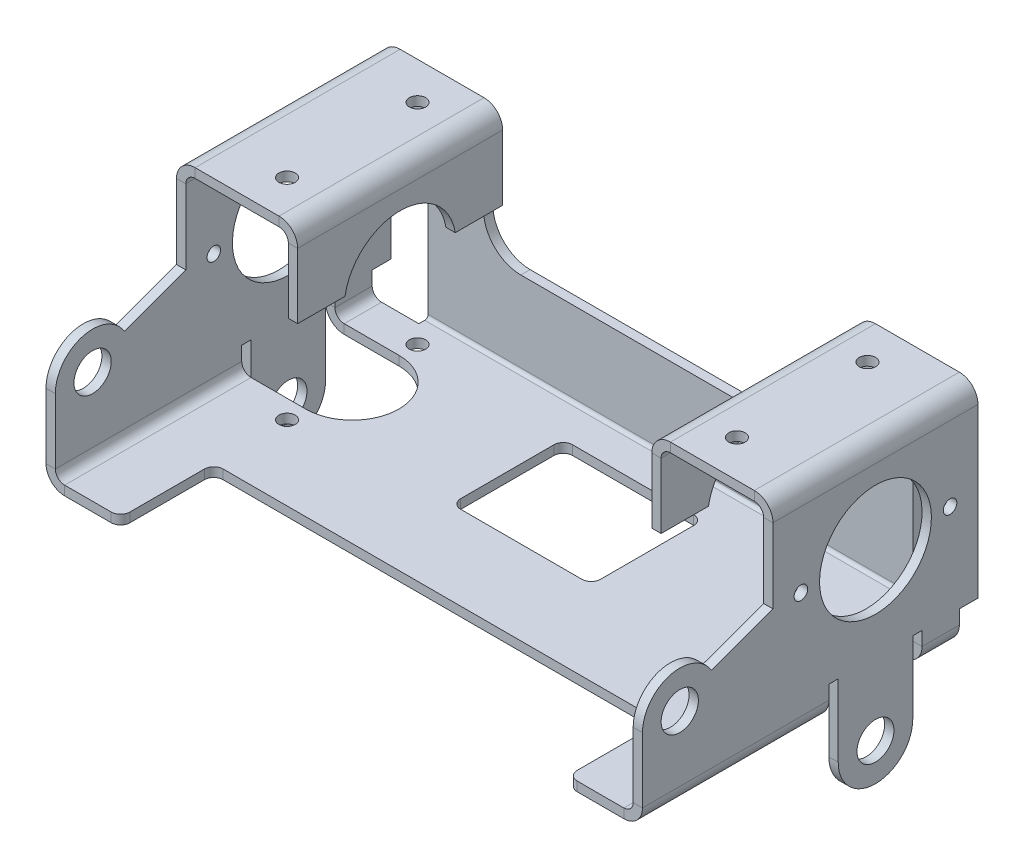
from build123d import *

# Parameters (mm, degrees)
BASE_FLANGE1_DEPTH           = 2
EDGE_FLANGE1_STRIP_W         = 12
EDGE_FLANGE1_STRIP_H         = 2
EDGE_FLANGE1_STRIP_CUT_DEPTH = 68
EDGE_FLANGE1_DEPTH           = 68
EDGE_FLANGE1_START           = 2
EDGE_FLANGE1_PROFILE_R       = 4
EDGE_FLANGE1_PROFILE_R_2     = 1.454422023
EDGE_FLANGE1_PROFILE_R_3     = 12
EDGE_FLANGE1_FLAT_DEPTH      = 2
UNFOLD1_START                = 2
UNFOLD1_DEPTH                = 45
UNFOLD1_2_OUTLINE_R          = 1.454422023
UNFOLD1_2_OUTLINE_R_2        = 4
UNFOLD1_2_OUTLINE_R_3        = 12
UNFOLD1_2_DEPTH              = 2
CUT_EXTRUDE1_REACH           = 128.481
SKETCH38_R                   = 1.75
FOLD1_START                  = -107.71238898
FOLD1_OUTLINE_W              = 2
FOLD1_OUTLINE_H              = 72
FOLD1_DEPTH                  = 44.12334898
FOLD1_START_2                = -62.01096
FOLD1_2_OUTLINE_R            = 1.454422023
FOLD1_2_OUTLINE_R_2          = 12
FOLD1_2_OUTLINE_R_3          = 4
FOLD1_2_DEPTH                = 0.01096
FOLD1_START_3                = -64
FOLD1_3_OUTLINE_R            = 1.454422023
FOLD1_3_OUTLINE_R_2          = 12
FOLD1_3_OUTLINE_R_3          = 4
FOLD1_3_DEPTH                = 4
FOLD1_START_4                = -5.731764935
FOLD1_4_DEPTH                = 72
SKETCH39_R                   = 4
TAB1_DEPTH                   = 2
EDGE_FLANGE2_STRIP_W         = 12
EDGE_FLANGE2_STRIP_H         = 2
EDGE_FLANGE2_STRIP_CUT_DEPTH = 44
EDGE_FLANGE2_DEPTH           = 44
EDGE_FLANGE2_PROFILE_W       = 44
EDGE_FLANGE2_PROFILE_H       = 22
EDGE_FLANGE2_PROFILE_R       = 1.75
EDGE_FLANGE2_FLAT_DEPTH      = 2
EDGE_FLANGE3_STRIP_W         = 12
EDGE_FLANGE3_STRIP_H         = 2
EDGE_FLANGE3_STRIP_CUT_DEPTH = 44
EDGE_FLANGE3_DEPTH           = 44
EDGE_FLANGE3_FLAT_DEPTH      = 2
UNFOLD2_START                = 2
UNFOLD2_OUTLINE_R            = 1.75
UNFOLD2_DEPTH                = 45
UNFOLD2_2_OUTLINE_R          = 4
UNFOLD2_2_OUTLINE_R_2        = 1.454422023
UNFOLD2_2_DEPTH              = 2
UNFOLD2_START_2              = 4
UNFOLD2_3_OUTLINE_W          = 2
UNFOLD2_3_OUTLINE_H          = 44
UNFOLD2_3_DEPTH              = 9.975076938
UNFOLD2_START_3              = 17.475077138
UNFOLD2_4_OUTLINE_W          = 2
UNFOLD2_4_OUTLINE_H          = 44
UNFOLD2_4_DEPTH              = 4.524922862
UNFOLD2_START_4              = 1.78876
UNFOLD2_5_DEPTH              = 0.21124
UNFOLD2_START_5              = 38.268235065
UNFOLD2_6_DEPTH              = 28
UNFOLD2_START_6              = -5.731764935
UNFOLD2_7_OUTLINE_W          = 2
UNFOLD2_7_OUTLINE_H          = 3.5000002
UNFOLD2_7_DEPTH              = 44
UNFOLD2_START_7              = -1.731764935
UNFOLD2_8_DEPTH              = 68
UNFOLD2_START_8              = -1
UNFOLD2_9_DEPTH              = 27
UNFOLD2_START_9              = 105
UNFOLD2_10_OUTLINE_R         = 1.75
UNFOLD2_10_DEPTH             = 4
CUT_EXTRUDE2_REACH           = 136.233
SKETCH48_R                   = 1.75
FOLD2_START                  = -5.731764935
FOLD2_DEPTH                  = 72
FOLD2_2_DEPTH                = 72
FOLD2_START_2                = 26.268235065
FOLD2_3_DEPTH                = 40
FOLD2_START_3                = -1.731764935
FOLD2_4_DEPTH                = 8
FOLD2_START_4                = 38
FOLD2_5_OUTLINE_R            = 4
FOLD2_5_OUTLINE_R_2          = 1.454422023
FOLD2_5_DEPTH                = 26
FOLD2_START_5                = 45
FOLD2_6_OUTLINE_R            = 1.75
FOLD2_6_DEPTH                = 2
TAB2_START                   = -2
SKETCH51_R                   = 3.965306051
TAB2_DEPTH                   = 2
EDGE_FLANGE5_STRIP_W         = 9.4732
EDGE_FLANGE5_STRIP_H         = 2
EDGE_FLANGE5_STRIP_CUT_DEPTH = 104
EDGE_FLANGE5_DEPTH           = 104
EDGE_FLANGE5_FLAT_DEPTH      = 2


with BuildPart() as part:
    # Base-Flange1: sheet metal written as solids
    # Sketch2 → Base-Flange1 (new body)
    with BuildSketch(Plane(origin=(0, 0, 0), x_dir=(1, 0, 0), z_dir=(0, 1, 0))):
        with BuildLine():
            Line((-60, -66.268235065), (-50, -66.268235065))
            ThreePointArc((-50, -66.268235065), (-48.585786438, -65.682448628), (-48, -64.268235065))
            Line((-48, -64.268235065), (-48, -48.268235065))
            ThreePointArc((-48, -48.268235065), (-47.414213562, -46.854021503), (-46, -46.268235065))
            Line((-46, -46.268235065), (46, -46.268235065))
            ThreePointArc((46, -46.268235065), (47.414213562, -46.854021503), (48, -48.268235065))
            Line((48, -48.268235065), (48, -64.268235065))
            ThreePointArc((48, -64.268235065), (48.585786438, -65.682448628), (50, -66.268235065))
            Line((50, -66.268235065), (60, -66.268235065))
            Line((60, -66.268235065), (62, -66.268235065))
            Line((62, -66.268235065), (62, 1.731764935))
            Line((62, 1.731764935), (60, 1.731764935))
            Line((60, 1.731764935), (52, 1.731764935))
            Line((52, 1.731764935), (52, 5.731764935))
            Line((52, 5.731764935), (-52, 5.731764935))
            Line((-52, 5.731764935), (-52, 1.731764935))
            Line((-52, 1.731764935), (-60, 1.731764935))
            Line((-60, 1.731764935), (-62, 1.731764935))
            Line((-62, 1.731764935), (-62, -66.268235065))
            Line((-62, -66.268235065), (-60, -66.268235065))
        make_face()
        with BuildLine():
            Line((-13, -4.268235065), (13, -4.268235065))
            ThreePointArc((13, -4.268235065), (14.414213562, -4.854021503), (15, -6.268235065))
            Line((15, -6.268235065), (15, -26.268235065))
            ThreePointArc((15, -26.268235065), (14.414213562, -27.682448628), (13, -28.268235065))
            Line((13, -28.268235065), (-13, -28.268235065))
            ThreePointArc((-13, -28.268235065), (-14.414213562, -27.682448628), (-15, -26.268235065))
            Line((-15, -26.268235065), (-15, -6.268235065))
            ThreePointArc((-15, -6.268235065), (-14.414213562, -4.854021503), (-13, -4.268235065))
        make_face(mode=Mode.SUBTRACT)
    extrude(amount=BASE_FLANGE1_DEPTH)

    # Edge-Flange1: sheet metal written as solids
    # Edge-Flange1 strip (on a plane across the edge) → Edge-Flange1 strip cut (cut)
    with BuildSketch(Plane(origin=(-62, 2, -1.731764935), x_dir=(1, 0, 0), z_dir=(0, 0, 1))):
        with Locations((-4, -1)):
            Rectangle(EDGE_FLANGE1_STRIP_W, EDGE_FLANGE1_STRIP_H)
    edge_flange1_strip_cut = extrude(amount=EDGE_FLANGE1_STRIP_CUT_DEPTH, mode=Mode.SUBTRACT)

    # Edge-Flange1 bend section (on a plane across the edge) → Edge-Flange1 (add)
    with BuildSketch(Plane(origin=(-62, 2, -1.731764935), x_dir=(1, 0, 0), z_dir=(0, 0, 1))):
        with BuildLine():
            Line((-2, 2), (0, 2))
            ThreePointArc((0, 2), (0.585786438, 0.585786438), (2, 0))
            Line((2, 0), (2, -2))
            ThreePointArc((2, -2), (-0.828427125, -0.828427125), (-2, 2))
        make_face()
    edge_flange1 = extrude(amount=EDGE_FLANGE1_DEPTH)

    # Edge-Flange1 profile (on flange) → Edge-Flange1 flat (add)
    with BuildSketch(Plane(origin=(-62, 2, 0), x_dir=(0, 0, 1), z_dir=(-1, 0, 0)).offset(EDGE_FLANGE1_START)):
        with BuildLine():
            Line((66.268235065, 2), (66.268235065, 16))
            ThreePointArc((66.268235065, 16), (60.450508139, 23.696602123), (51.458814007, 20.199021892))
            Line((51.458814007, 20.199021892), (38.268235065, 25))
            Line((38.268235065, 25), (38.268235065, 45))
            Line((38.268235065, 45), (-5.731764935, 45))
            Line((-5.731764935, 45), (-5.731764935, 5))
            Line((-5.731764935, 5), (-1.731764935, 5))
            Line((-1.731764935, 5), (-1.731764935, 2))
            Line((-1.731764935, 2), (66.268235065, 2))
        make_face()
        with Locations((58.268235065, 16)):
            Circle(EDGE_FLANGE1_PROFILE_R, mode=Mode.SUBTRACT)
        with Locations((32.268235065, 25)):
            Circle(EDGE_FLANGE1_PROFILE_R_2, mode=Mode.SUBTRACT)
        with Locations((16.268235065, 25)):
            Circle(EDGE_FLANGE1_PROFILE_R_3, mode=Mode.SUBTRACT)
        with Locations((0.268235065, 25)):
            Circle(EDGE_FLANGE1_PROFILE_R_2, mode=Mode.SUBTRACT)
    edge_flange1_flat = extrude(amount=-EDGE_FLANGE1_FLAT_DEPTH)

    # Unfold1: read off the stored shape, not the designer's step
    # Unfold1 outline → Unfold1 (cut)
    with BuildSketch(Plane(origin=(0, 0, 0), x_dir=(1, 0, 0), z_dir=(0, 1, 0)).offset(UNFOLD1_START)):
        Polygon((-64, 1.731764935), (-64.71238898, 1.731764935), (-64.71238898, -66.268235065), (-60, -66.268235065), (-60, 1.731764935), (-62, 1.731764935), (-62, 5.731764935), (-64, 5.731764935), align=None)
    extrude(amount=UNFOLD1_DEPTH, mode=Mode.SUBTRACT)

    # Unfold1 2 outline → Unfold1 2 (add)
    with BuildSketch(Plane(origin=(0, 0, 0), x_dir=(1, 0, 0), z_dir=(0, 1, 0))):
        with BuildLine():
            Line((-67.71238898, 1.731764935), (-67.71238898, 5.731764935))
            Line((-67.71238898, 5.731764935), (-107.71238898, 5.731764935))
            Line((-107.71238898, 5.731764935), (-107.71238898, -38.268235065))
            Line((-107.71238898, -38.268235065), (-87.71238898, -38.268235065))
            Line((-87.71238898, -38.268235065), (-82.911410873, -51.458814007))
            ThreePointArc((-82.911410873, -51.458814007), (-86.408991103, -60.450508139), (-78.71238898, -66.268235065))
            Line((-78.71238898, -66.268235065), (-60, -66.268235065))
            Line((-60, -66.268235065), (-60, 1.731764935))
            Line((-60, 1.731764935), (-67.71238898, 1.731764935))
        make_face()
        with Locations((-87.71238898, -32.268235065)):
            Circle(UNFOLD1_2_OUTLINE_R, mode=Mode.SUBTRACT)
        with Locations((-78.71238898, -58.268235065)):
            Circle(UNFOLD1_2_OUTLINE_R_2, mode=Mode.SUBTRACT)
        with Locations((-87.71238898, -16.268235065)):
            Circle(UNFOLD1_2_OUTLINE_R_3, mode=Mode.SUBTRACT)
        with Locations((-87.71238898, -0.268235065)):
            Circle(UNFOLD1_2_OUTLINE_R, mode=Mode.SUBTRACT)
    extrude(amount=UNFOLD1_2_DEPTH)

    # Sketch38 → Cut-Extrude1 (cut, up to next)
    with BuildSketch(Plane(origin=(0, 2, 0), x_dir=(1, 0, 0), z_dir=(0, 1, 0)), mode=Mode.PRIVATE) as cut_extrude1_sk1:
        with Locations(Location((-48.274922962, -2.268235065, 0), (0, 0, 270))):
            Circle(SKETCH38_R)
    cut_extrude1_tool1 = extrude(cut_extrude1_sk1.sketch, amount=-CUT_EXTRUDE1_REACH, mode=Mode.PRIVATE) & part.part
    # Sketch38 → Cut-Extrude1 (cut, up to next)
    with BuildSketch(Plane(origin=(0, 2, 0), x_dir=(1, 0, 0), z_dir=(0, 1, 0)), mode=Mode.PRIVATE) as cut_extrude1_sk2:
        with Locations(Location((-48.274922962, -30.268235065, 0), (0, 0, 270))):
            Circle(SKETCH38_R)
    cut_extrude1_tool2 = extrude(cut_extrude1_sk2.sketch, amount=-CUT_EXTRUDE1_REACH, mode=Mode.PRIVATE) & part.part
    # Sketch38 → Cut-Extrude1 (cut, up to next)
    with BuildSketch(Plane(origin=(0, 2, 0), x_dir=(1, 0, 0), z_dir=(0, 1, 0)), mode=Mode.PRIVATE) as cut_extrude1_sk3:
        with BuildLine():
            Line((-67.71238898, -6.268235065), (-48.274922962, -6.268235065))
            ThreePointArc((-48.274922962, -6.268235065), (-38.274922962, -16.268235065), (-48.274922962, -26.268235065))
            Line((-48.274922962, -26.268235065), (-67.71238898, -26.268235065))
            Line((-67.71238898, -26.268235065), (-67.71238898, -6.268235065))
        make_face()
    cut_extrude1_tool3 = extrude(cut_extrude1_sk3.sketch, amount=-CUT_EXTRUDE1_REACH, mode=Mode.PRIVATE) & part.part
    add(cut_extrude1_tool1.solids().sort_by_distance((-48.274923, 2, 2.268235))[0], mode=Mode.SUBTRACT)
    add(cut_extrude1_tool2.solids().sort_by_distance((-48.274923, 2, 30.268235))[0], mode=Mode.SUBTRACT)
    add(cut_extrude1_tool3.solids().sort_by_distance((-53.975398, 2, 16.268235))[0], mode=Mode.SUBTRACT)

    # Fold1: read off the stored shape, not the designer's step
    # Fold1 outline → Fold1 (cut)
    with BuildSketch(Plane.YZ.offset(FOLD1_START)):
        with Locations((1, 30.268235065)):
            Rectangle(FOLD1_OUTLINE_W, FOLD1_OUTLINE_H)
    extrude(amount=FOLD1_DEPTH, mode=Mode.SUBTRACT)

    # Fold1 2 outline → Fold1 2 (add)
    with BuildSketch(Plane.YZ.offset(FOLD1_START_2)):
        with BuildLine():
            Line((2, 26.268235065), (7, 26.268235065))
            Line((7, 26.268235065), (7, 6.268235065))
            Line((7, 6.268235065), (2, 6.268235065))
            Line((2, 6.268235065), (2, -1.731764935))
            Line((2, -1.731764935), (7, -1.731764935))
            Line((7, -1.731764935), (7, -5.731764935))
            Line((7, -5.731764935), (47, -5.731764935))
            Line((47, -5.731764935), (47, 38.268235065))
            Line((47, 38.268235065), (27, 38.268235065))
            Line((27, 38.268235065), (22.199021892, 51.458814007))
            ThreePointArc((22.199021892, 51.458814007), (25.696602123, 60.450508139), (18, 66.268235065))
            Line((18, 66.268235065), (2, 66.268235065))
            Line((2, 66.268235065), (2, 26.268235065))
        make_face()
        with Locations((27, 0.268235065)):
            Circle(FOLD1_2_OUTLINE_R, mode=Mode.SUBTRACT)
        with Locations((27, 16.268235065)):
            Circle(FOLD1_2_OUTLINE_R_2, mode=Mode.SUBTRACT)
        with Locations((18, 58.268235065)):
            Circle(FOLD1_2_OUTLINE_R_3, mode=Mode.SUBTRACT)
        with Locations((27, 32.268235065)):
            Circle(FOLD1_2_OUTLINE_R, mode=Mode.SUBTRACT)
    extrude(amount=FOLD1_2_DEPTH)

    # Fold1 3 outline → Fold1 3 (add)
    with BuildSketch(Plane.YZ.offset(FOLD1_START_3)):
        with BuildLine():
            Line((2, 26.268235065), (7, 26.268235065))
            Line((7, 26.268235065), (7, 6.268235065))
            Line((7, 6.268235065), (2, 6.268235065))
            Line((2, 6.268235065), (2, -1.731764935))
            Line((2, -1.731764935), (7, -1.731764935))
            Line((7, -1.731764935), (7, -5.731764935))
            Line((7, -5.731764935), (47, -5.731764935))
            Line((47, -5.731764935), (47, 38.268235065))
            Line((47, 38.268235065), (27, 38.268235065))
            Line((27, 38.268235065), (22.199021892, 51.458814007))
            ThreePointArc((22.199021892, 51.458814007), (25.696602123, 60.450508139), (18, 66.268235065))
            Line((18, 66.268235065), (2, 66.268235065))
            Line((2, 66.268235065), (2, 26.268235065))
        make_face()
        with Locations((27, 0.268235065)):
            Circle(FOLD1_3_OUTLINE_R, mode=Mode.SUBTRACT)
        with Locations((27, 16.268235065)):
            Circle(FOLD1_3_OUTLINE_R_2, mode=Mode.SUBTRACT)
        with Locations((18, 58.268235065)):
            Circle(FOLD1_3_OUTLINE_R_3, mode=Mode.SUBTRACT)
        with Locations((27, 32.268235065)):
            Circle(FOLD1_3_OUTLINE_R, mode=Mode.SUBTRACT)
    extrude(amount=FOLD1_3_DEPTH)

    # Fold1 4 outline → Fold1 4 (cut)
    with BuildSketch(Plane.XY.offset(FOLD1_START_4)):
        with BuildLine():
            Line((-60, 47), (-62, 47))
            Line((-62, 47), (-62, 4))
            ThreePointArc((-62, 4), (-61.414213562, 2.585786438), (-60, 2))
            Line((-60, 2), (-60, 47))
        make_face()
        with BuildLine():
            ThreePointArc((-60, 0), (-62.828427125, 1.171572875), (-64, 4))
            Line((-64, 4), (-64, 2))
            Line((-64, 2), (-63.58904, 2))
            Line((-63.58904, 2), (-63.58904, 0))
            Line((-63.58904, 0), (-60, 0))
        make_face()
    extrude(amount=FOLD1_4_DEPTH, mode=Mode.SUBTRACT)

    # Tab1: sheet metal written as solids
    # Sketch39 → Tab1 (add)
    with BuildSketch(Plane.ZY.offset(64)):
        with BuildLine():
            Line((8.268235065, 7), (24.268235065, 7))
            Line((24.268235065, 7), (24.268235065, -8.507457044))
            ThreePointArc((24.268235065, -8.507457044), (16.268235065, -16.507457044), (8.268235065, -8.507457044))
            Line((8.268235065, -8.507457044), (8.268235065, 7))
        make_face()
        with Locations(Location((16.268235065, -8.507457044, 0), (0, 0, 270))):
            Circle(SKETCH39_R, mode=Mode.SUBTRACT)
    extrude(amount=-TAB1_DEPTH)

    # Edge-Flange2: sheet metal written as solids
    # Edge-Flange2 strip (on a plane across the edge) → Edge-Flange2 strip cut (cut)
    with BuildSketch(Plane(origin=(-62, 47, -5.731764935), x_dir=(0, -1, 0), z_dir=(0, 0, 1))):
        with Locations((-2, -1)):
            Rectangle(EDGE_FLANGE2_STRIP_W, EDGE_FLANGE2_STRIP_H)
    edge_flange2_strip_cut = extrude(amount=EDGE_FLANGE2_STRIP_CUT_DEPTH, mode=Mode.SUBTRACT)

    # Edge-Flange2 bend section (on a plane across the edge) → Edge-Flange2 (add)
    with BuildSketch(Plane(origin=(-62, 47, -5.731764935), x_dir=(0, -1, 0), z_dir=(0, 0, 1))):
        with BuildLine():
            Line((0, 2), (2, 2))
            ThreePointArc((2, 2), (2.585786438, 0.585786438), (4, 0))
            Line((4, 0), (4, -2))
            ThreePointArc((4, -2), (1.171572875, -0.828427125), (0, 2))
        make_face()
    edge_flange2 = extrude(amount=EDGE_FLANGE2_DEPTH)

    # Edge-Flange2 profile (on flange) → Edge-Flange2 flat (add)
    with BuildSketch(Plane(origin=(-62, 47, 0), x_dir=(0, 0, 1), z_dir=(0, 1, 0))):
        with Locations((16.268235065, 13)):
            Rectangle(EDGE_FLANGE2_PROFILE_W, EDGE_FLANGE2_PROFILE_H)
        with Locations((30.268235065, 13.725077038)):
            Circle(EDGE_FLANGE2_PROFILE_R, mode=Mode.SUBTRACT)
        with Locations((2.268235065, 13.725077038)):
            Circle(EDGE_FLANGE2_PROFILE_R, mode=Mode.SUBTRACT)
    edge_flange2_flat = extrude(amount=-EDGE_FLANGE2_FLAT_DEPTH)

    # Edge-Flange3: sheet metal written as solids
    # Edge-Flange3 strip (on a plane across the edge) → Edge-Flange3 strip cut (cut)
    with BuildSketch(Plane(origin=(-38, 45, -5.731764935), x_dir=(-1, 0, 0), z_dir=(0, 0, 1))):
        with Locations((-2, -1)):
            Rectangle(EDGE_FLANGE3_STRIP_W, EDGE_FLANGE3_STRIP_H)
    edge_flange3_strip_cut = extrude(amount=EDGE_FLANGE3_STRIP_CUT_DEPTH, mode=Mode.SUBTRACT)

    # Edge-Flange3 bend section (on a plane across the edge) → Edge-Flange3 (add)
    with BuildSketch(Plane(origin=(-38, 45, -5.731764935), x_dir=(-1, 0, 0), z_dir=(0, 0, 1))):
        with BuildLine():
            Line((0, 2), (2, 2))
            ThreePointArc((2, 2), (2.585786438, 0.585786438), (4, 0))
            Line((4, 0), (4, -2))
            ThreePointArc((4, -2), (1.171572875, -0.828427125), (0, 2))
        make_face()
    edge_flange3 = extrude(amount=EDGE_FLANGE3_DEPTH)

    # Edge-Flange3 profile (on flange) → Edge-Flange3 flat (add)
    with BuildSketch(Plane(origin=(-38, 45, 0), x_dir=(0, 0, 1), z_dir=(1, 0, 0))):
        with BuildLine():
            ThreePointArc((28.100394631, 16), (16.268235065, 6), (4.436075499, 16))
            Line((4.436075499, 16), (-5.731764935, 16))
            Line((-5.731764935, 16), (-5.731764935, 2))
            Line((-5.731764935, 2), (38.268235065, 2))
            Line((38.268235065, 2), (38.268235065, 16))
            Line((38.268235065, 16), (28.100394631, 16))
        make_face()
    edge_flange3_flat = extrude(amount=-EDGE_FLANGE3_FLAT_DEPTH)

    # Mirror2: Edge-Flange1 strip cut, Edge-Flange1, Edge-Flange1 flat, Edge-Flange2 strip cut, Edge-Flange2, Edge-Flange2 flat, Edge-Flange3 strip cut, Edge-Flange3, Edge-Flange3 flat across plane
    add(edge_flange1_strip_cut.mirror(Plane(origin=(0, 0, 0), x_dir=(0, 0, 1), z_dir=(1, 0, 0))), mode=Mode.SUBTRACT)
    add(edge_flange1.mirror(Plane(origin=(0, 0, 0), x_dir=(0, 0, 1), z_dir=(1, 0, 0))))
    add(edge_flange1_flat.mirror(Plane(origin=(0, 0, 0), x_dir=(0, 0, 1), z_dir=(1, 0, 0))))
    add(edge_flange2_strip_cut.mirror(Plane(origin=(0, 0, 0), x_dir=(0, 0, 1), z_dir=(1, 0, 0))), mode=Mode.SUBTRACT)
    add(edge_flange2.mirror(Plane(origin=(0, 0, 0), x_dir=(0, 0, 1), z_dir=(1, 0, 0))))
    add(edge_flange2_flat.mirror(Plane(origin=(0, 0, 0), x_dir=(0, 0, 1), z_dir=(1, 0, 0))))
    add(edge_flange3_strip_cut.mirror(Plane(origin=(0, 0, 0), x_dir=(0, 0, 1), z_dir=(1, 0, 0))), mode=Mode.SUBTRACT)
    add(edge_flange3.mirror(Plane(origin=(0, 0, 0), x_dir=(0, 0, 1), z_dir=(1, 0, 0))))
    add(edge_flange3_flat.mirror(Plane(origin=(0, 0, 0), x_dir=(0, 0, 1), z_dir=(1, 0, 0))))

    # Unfold2: read off the stored shape, not the designer's step
    # Unfold2 outline → Unfold2 (cut)
    with BuildSketch(Plane(origin=(0, 0, 0), x_dir=(1, 0, 0), z_dir=(0, 1, 0)).offset(UNFOLD2_START)):
        Polygon((64, 5.731764935), (38, 5.731764935), (38, -38.268235065), (62, -38.268235065), (62, -66.268235065), (64, -66.268235065), align=None)
        with Locations((48.274922962, -30.268235065)):
            Circle(UNFOLD2_OUTLINE_R, mode=Mode.SUBTRACT)
        with Locations((48.274922962, -2.268235065)):
            Circle(UNFOLD2_OUTLINE_R, mode=Mode.SUBTRACT)
    extrude(amount=UNFOLD2_DEPTH, mode=Mode.SUBTRACT)

    # Unfold2 2 outline → Unfold2 2 (add)
    with BuildSketch(Plane(origin=(0, 0, 0), x_dir=(1, 0, 0), z_dir=(0, 1, 0))):
        with BuildLine():
            Line((67.71238898, 1.731764935), (62, 1.731764935))
            Line((62, 1.731764935), (62, -66.268235065))
            Line((62, -66.268235065), (78.71238898, -66.268235065))
            ThreePointArc((78.71238898, -66.268235065), (86.408991103, -60.450508139), (82.911410873, -51.458814007))
            Line((82.911410873, -51.458814007), (87.71238898, -38.268235065))
            Line((87.71238898, -38.268235065), (89.71238898, -38.268235065))
            Line((89.71238898, -38.268235065), (89.71238898, -28.100394631))
            ThreePointArc((89.71238898, -28.100394631), (75.71238898, -16.268235065), (89.71238898, -4.436075499))
            Line((89.71238898, -4.436075499), (89.71238898, 5.731764935))
            Line((89.71238898, 5.731764935), (67.71238898, 5.731764935))
            Line((67.71238898, 5.731764935), (67.71238898, 1.731764935))
        make_face()
        with Locations((78.71238898, -58.268235065)):
            Circle(UNFOLD2_2_OUTLINE_R, mode=Mode.SUBTRACT)
        with Locations((87.71238898, -32.268235065)):
            Circle(UNFOLD2_2_OUTLINE_R_2, mode=Mode.SUBTRACT)
        with Locations((87.71238898, -0.268235065)):
            Circle(UNFOLD2_2_OUTLINE_R_2, mode=Mode.SUBTRACT)
    extrude(amount=UNFOLD2_2_DEPTH)

    # Unfold2 5 outline → Unfold2 5 (add)
    with BuildSketch(Plane(origin=(0, 0, 0), x_dir=(1, 0, 0), z_dir=(0, 1, 0)).offset(UNFOLD2_START_4)):
        with BuildLine():
            Line((105.71238898, 5.731764935), (89.71238898, 5.731764935))
            Line((89.71238898, 5.731764935), (89.71238898, -4.436075499))
            ThreePointArc((89.71238898, -4.436075499), (99.71238898, -16.268235065), (89.71238898, -28.100394631))
            Line((89.71238898, -28.100394631), (89.71238898, -38.268235065))
            Line((89.71238898, -38.268235065), (105.71238898, -38.268235065))
            Line((105.71238898, -38.268235065), (105.71238898, 5.731764935))
        make_face()
    extrude(amount=UNFOLD2_5_DEPTH)

    # Unfold2 6 outline → Unfold2 6 (cut)
    with BuildSketch(Plane.XY.offset(UNFOLD2_START_5)):
        with BuildLine():
            Line((60, 2), (62, 2))
            Line((62, 2), (62, 4))
            ThreePointArc((62, 4), (61.414213562, 2.585786438), (60, 2))
        make_face()
    extrude(amount=UNFOLD2_6_DEPTH, mode=Mode.SUBTRACT)



with BuildPart() as body_2:
    # Unfold2 3 outline → Unfold2 3 (new body)
    with BuildSketch(Plane(origin=(0, 0, 0), x_dir=(1, 0, 0), z_dir=(0, 1, 0)).offset(UNFOLD2_START_2)):
        with Locations((106.71238898, -16.268235065)):
            Rectangle(UNFOLD2_3_OUTLINE_W, UNFOLD2_3_OUTLINE_H)
    extrude(amount=UNFOLD2_3_DEPTH)


with BuildPart() as body_3:
    # Unfold2 4 outline → Unfold2 4 (new body)
    with BuildSketch(Plane(origin=(0, 0, 0), x_dir=(1, 0, 0), z_dir=(0, 1, 0)).offset(UNFOLD2_START_3)):
        with Locations((106.71238898, -16.268235065)):
            Rectangle(UNFOLD2_4_OUTLINE_W, UNFOLD2_4_OUTLINE_H)
    extrude(amount=UNFOLD2_4_DEPTH)


with BuildPart() as part_1:
    add(part.part)

    add(body_2.part)  # Unfold2 7 merges body 2

    add(body_3.part)  # Unfold2 7 merges body 3
    # Unfold2 7 outline → Unfold2 7 (add)
    with BuildSketch(Plane.XY.offset(UNFOLD2_START_6)):
        with BuildLine():
            ThreePointArc((105.71238898, 4), (105.126602542, 2.585786437), (103.71238898, 2))
            Line((103.71238898, 2), (105.71238898, 2))
            Line((105.71238898, 2), (105.71238898, 1.78876))
            Line((105.71238898, 1.78876), (89.71238898, 1.78876))
            Line((89.71238898, 1.78876), (89.71238898, 0))
            Line((89.71238898, 0), (103.71238898, 0))
            ThreePointArc((103.71238898, 0), (106.540816105, 1.171572875), (107.71238898, 4))
            Line((107.71238898, 4), (105.71238898, 4))
        make_face()
        with Locations((106.71238898, 15.725077038)):
            Rectangle(UNFOLD2_7_OUTLINE_W, UNFOLD2_7_OUTLINE_H)
        with BuildLine():
            ThreePointArc((103.71238898, 24), (105.126602542, 23.414213563), (105.71238898, 22))
            Line((105.71238898, 22), (107.71238898, 22))
            ThreePointArc((107.71238898, 22), (106.540816105, 24.828427125), (103.71238898, 26))
            Line((103.71238898, 26), (89.71238898, 26))
            Line((89.71238898, 26), (89.71238898, 24))
            Line((89.71238898, 24), (103.71238898, 24))
        make_face()
    extrude(amount=UNFOLD2_7_DEPTH)

    # Unfold2 8 outline → Unfold2 8 (add)
    with BuildSketch(Plane.XY.offset(UNFOLD2_START_7)):
        with BuildLine():
            Line((60, 0), (62, 0))
            Line((62, 0), (62, 0.535898385))
            ThreePointArc((62, 0.535898385), (61.03527618, 0.136296695), (60, 0))
        make_face()
    extrude(amount=UNFOLD2_8_DEPTH)

    # Unfold2 9 outline → Unfold2 9 (cut)
    with BuildSketch(Plane(origin=(0, 0, 0), x_dir=(1, 0, 0), z_dir=(0, 1, 0)).offset(UNFOLD2_START_8)):
        with BuildLine():
            ThreePointArc((89.71238898, -28.100394631), (99.71238898, -16.268235065), (89.71238898, -4.436075499))
            Line((89.71238898, -4.436075499), (89.71238898, -28.100394631))
        make_face()
    extrude(amount=UNFOLD2_9_DEPTH, mode=Mode.SUBTRACT)

    # Unfold2 10 outline → Unfold2 10 (cut)
    with BuildSketch(Plane.YZ.offset(UNFOLD2_START_9)):
        with Locations((15.725077038, 2.268235065)):
            Circle(UNFOLD2_10_OUTLINE_R)
        with Locations((15.725077038, 30.268235065)):
            Circle(UNFOLD2_10_OUTLINE_R)
    extrude(amount=UNFOLD2_10_DEPTH, mode=Mode.SUBTRACT)

    # Sketch48 → Cut-Extrude2 (cut, up to next)
    with BuildSketch(Plane(origin=(0, 2, 0), x_dir=(1, 0, 0), z_dir=(0, 1, 0)), mode=Mode.PRIVATE) as cut_extrude2_sk1:
        with Locations(Location((52.71238898, -2.268235065, 0), (0, 0, 270))):
            Circle(SKETCH48_R)
    cut_extrude2_tool1 = extrude(cut_extrude2_sk1.sketch, amount=-CUT_EXTRUDE2_REACH, mode=Mode.PRIVATE) & part_1.part
    # Sketch48 → Cut-Extrude2 (cut, up to next)
    with BuildSketch(Plane(origin=(0, 2, 0), x_dir=(1, 0, 0), z_dir=(0, 1, 0)), mode=Mode.PRIVATE) as cut_extrude2_sk2:
        with Locations(Location((52.71238898, -30.268235065, 0), (0, 0, 270))):
            Circle(SKETCH48_R)
    cut_extrude2_tool2 = extrude(cut_extrude2_sk2.sketch, amount=-CUT_EXTRUDE2_REACH, mode=Mode.PRIVATE) & part_1.part
    # Sketch48 → Cut-Extrude2 (cut, up to next)
    with BuildSketch(Plane(origin=(0, 2, 0), x_dir=(1, 0, 0), z_dir=(0, 1, 0)), mode=Mode.PRIVATE) as cut_extrude2_sk3:
        with BuildLine():
            Line((67.71238898, -6.268235065), (52.71238898, -6.268235065))
            ThreePointArc((52.71238898, -6.268235065), (42.71238898, -16.268235065), (52.71238898, -26.268235065))
            Line((52.71238898, -26.268235065), (67.71238898, -26.268235065))
            Line((67.71238898, -26.268235065), (67.71238898, -6.268235065))
        make_face()
    cut_extrude2_tool3 = extrude(cut_extrude2_sk3.sketch, amount=-CUT_EXTRUDE2_REACH, mode=Mode.PRIVATE) & part_1.part
    add(cut_extrude2_tool1.solids().sort_by_distance((52.712389, 2, 2.268235))[0], mode=Mode.SUBTRACT)
    add(cut_extrude2_tool2.solids().sort_by_distance((52.712389, 2, 30.268235))[0], mode=Mode.SUBTRACT)
    add(cut_extrude2_tool3.solids().sort_by_distance((56.17641, 2, 16.268235))[0], mode=Mode.SUBTRACT)

    # Fold2: read off the stored shape, not the designer's step
    # Fold2 outline → Fold2 (cut)
    with BuildSketch(Plane.XY.offset(FOLD2_START)):
        with BuildLine():
            ThreePointArc((63.464101616, 2), (62, 0.535898385), (60, 0))
            Line((60, 0), (103.71238898, 0))
            ThreePointArc((103.71238898, 0), (106.540816105, 1.171572875), (107.71238898, 4))
            Line((107.71238898, 4), (107.71238898, 22))
            ThreePointArc((107.71238898, 22), (106.540816105, 24.828427125), (103.71238898, 26))
            Line((103.71238898, 26), (89.71238898, 26))
            Line((89.71238898, 26), (89.71238898, 24))
            Line((89.71238898, 24), (103.71238898, 24))
            ThreePointArc((103.71238898, 24), (105.126602542, 23.414213563), (105.71238898, 22))
            Line((105.71238898, 22), (105.71238898, 4))
            ThreePointArc((105.71238898, 4), (105.126602542, 2.585786437), (103.71238898, 2))
            Line((103.71238898, 2), (63.464101616, 2))
        make_face()
    extrude(amount=FOLD2_DEPTH, mode=Mode.SUBTRACT)



with BuildPart() as body_2_2:
    # Fold2 2 outline → Fold2 2 (new body)
    with BuildSketch(Plane.XY.offset(FOLD2_START)):
        with BuildLine():
            Line((60, 47), (42, 47))
            ThreePointArc((42, 47), (39.171572875, 45.828427125), (38, 43))
            Line((38, 43), (38, 29))
            Line((38, 29), (40, 29))
            Line((40, 29), (40, 43))
            ThreePointArc((40, 43), (40.585786438, 44.414213562), (42, 45))
            Line((42, 45), (60, 45))
            ThreePointArc((60, 45), (61.414213562, 44.414213562), (62, 43))
            Line((62, 43), (62, 7))
            Line((62, 7), (64, 7))
            Line((64, 7), (64, 43))
            ThreePointArc((64, 43), (62.828427125, 45.828427125), (60, 47))
        make_face()
    extrude(amount=FOLD2_2_DEPTH)


with BuildPart() as part_2:
    add(part_1.part)

    add(body_2_2.part)  # Fold2 3 merges body 2 2
    # Fold2 3 outline → Fold2 3 (add)
    with BuildSketch(Plane.XY.offset(FOLD2_START_2)):
        with BuildLine():
            Line((64, 4), (64, 7))
            Line((64, 7), (62, 7))
            Line((62, 7), (62, 4))
            ThreePointArc((62, 4), (61.414213562, 2.585786438), (60, 2))
            Line((60, 2), (63.464101616, 2))
            ThreePointArc((63.464101616, 2), (63.863703305, 2.96472382), (64, 4))
        make_face()
    extrude(amount=FOLD2_3_DEPTH)

    # Fold2 4 outline → Fold2 4 (add)
    with BuildSketch(Plane.XY.offset(FOLD2_START_3)):
        with BuildLine():
            Line((64, 4), (64, 7))
            Line((64, 7), (62, 7))
            Line((62, 7), (62, 4))
            ThreePointArc((62, 4), (61.414213562, 2.585786438), (60, 2))
            Line((60, 2), (63.464101616, 2))
            ThreePointArc((63.464101616, 2), (63.863703305, 2.96472382), (64, 4))
        make_face()
    extrude(amount=FOLD2_4_DEPTH)

    # Fold2 5 outline → Fold2 5 (cut)
    with BuildSketch(Plane.YZ.offset(FOLD2_START_4)):
        with BuildLine():
            ThreePointArc((29, 28.100394631), (15, 16.268235065), (29, 4.436075499))
            ThreePointArc((29, 4.436075499), (39, 16.268235065), (29, 28.100394631))
        make_face()
        with BuildLine():
            Line((47, 38.268235065), (47, 66.268235065))
            Line((47, 66.268235065), (18, 66.268235065))
            ThreePointArc((18, 66.268235065), (25.696602123, 60.450508139), (22.199021892, 51.458814007))
            Line((22.199021892, 51.458814007), (27, 38.268235065))
            Line((27, 38.268235065), (47, 38.268235065))
        make_face()
        with Locations((18, 58.268235065)):
            Circle(FOLD2_5_OUTLINE_R)
        with Locations((27, 0.268235065)):
            Circle(FOLD2_5_OUTLINE_R_2)
        with Locations((27, 32.268235065)):
            Circle(FOLD2_5_OUTLINE_R_2)
    extrude(amount=FOLD2_5_DEPTH, mode=Mode.SUBTRACT)

    # Fold2 6 outline → Fold2 6 (cut)
    with BuildSketch(Plane(origin=(0, 0, 0), x_dir=(1, 0, 0), z_dir=(0, 1, 0)).offset(FOLD2_START_5)):
        with Locations((48.274922962, -2.268235065)):
            Circle(FOLD2_6_OUTLINE_R)
        with Locations((48.274922962, -30.268235065)):
            Circle(FOLD2_6_OUTLINE_R)
    extrude(amount=FOLD2_6_DEPTH, mode=Mode.SUBTRACT)

    # Tab2: sheet metal written as solids
    # Sketch51 → Tab2 (add)
    with BuildSketch(Plane(origin=(64, 0, 0), x_dir=(0, 0, -1), z_dir=(1, 0, 0)).offset(TAB2_START)):
        with BuildLine():
            Line((-8.268235065, -8.507457044), (-8.268235065, 7))
            Line((-8.268235065, 7), (-24.268235065, 7))
            Line((-24.268235065, 7), (-24.268235065, -8.507457044))
            ThreePointArc((-24.268235065, -8.507457044), (-16.268235065, -16.507457044), (-8.268235065, -8.507457044))
        make_face()
        with Locations(Location((-16.268235065, -8.507457044, 0), (0, 0, 90))):
            Circle(SKETCH51_R, mode=Mode.SUBTRACT)
    extrude(amount=TAB2_DEPTH)

    # Edge-Flange5: sheet metal written as solids
    # Edge-Flange5 strip (on a plane across the edge) → Edge-Flange5 strip cut (cut)
    with BuildSketch(Plane(origin=(52, 2, -5.731764935), x_dir=(0, 0, 1), z_dir=(-1, 0, 0))):
        with Locations((-2, -1)):
            Rectangle(EDGE_FLANGE5_STRIP_W, EDGE_FLANGE5_STRIP_H)
    extrude(amount=EDGE_FLANGE5_STRIP_CUT_DEPTH, mode=Mode.SUBTRACT)

    # Edge-Flange5 bend section (on a plane across the edge) → Edge-Flange5 (add)
    with BuildSketch(Plane(origin=(52, 2, -5.731764935), x_dir=(0, 0, 1), z_dir=(-1, 0, 0))):
        with BuildLine():
            Line((0, 0.7366), (2, 0.7366))
            ThreePointArc((2, 0.7366), (2.215745145, 0.215745145), (2.7366, 0))
            Line((2.7366, 0), (2.7366, -2))
            ThreePointArc((2.7366, -2), (0.801531583, -1.198468417), (0, 0.7366))
        make_face()
    extrude(amount=EDGE_FLANGE5_DEPTH)

    # Edge-Flange5 profile (on flange) → Edge-Flange5 flat (add)
    with BuildSketch(Plane(origin=(0, 2, -5.731764935), x_dir=(-1, 0, 0), z_dir=(0, 0, -1))):
        with BuildLine():
            Line((-52, 34), (-52, 0.7366))
            Line((-52, 0.7366), (52, 0.7366))
            Line((52, 0.7366), (52, 34))
            Line((52, 34), (61.9, 34))
            Line((61.9, 34), (61.9, 41))
            ThreePointArc((61.9, 41), (61.343502884, 42.343502884), (60, 42.9))
            Line((60, 42.9), (42, 42.9))
            ThreePointArc((42, 42.9), (40.656497116, 42.343502884), (40.1, 41))
            Line((40.1, 41), (40.1, 27))
            Line((40.1, 27), (40.1, 26))
            ThreePointArc((40.1, 26), (37.756854249, 20.343145751), (32.1, 18))
            Line((32.1, 18), (-32.1, 18))
            ThreePointArc((-32.1, 18), (-37.756854249, 20.343145751), (-40.1, 26))
            Line((-40.1, 26), (-40.1, 27))
            Line((-40.1, 27), (-40.1, 41))
            ThreePointArc((-40.1, 41), (-40.656497116, 42.343502884), (-42, 42.9))
            Line((-42, 42.9), (-60, 42.9))
            ThreePointArc((-60, 42.9), (-61.343502884, 42.343502884), (-61.9, 41))
            Line((-61.9, 41), (-61.9, 34))
            Line((-61.9, 34), (-52, 34))
        make_face()
    extrude(amount=-EDGE_FLANGE5_FLAT_DEPTH)


solid = part_2.part
